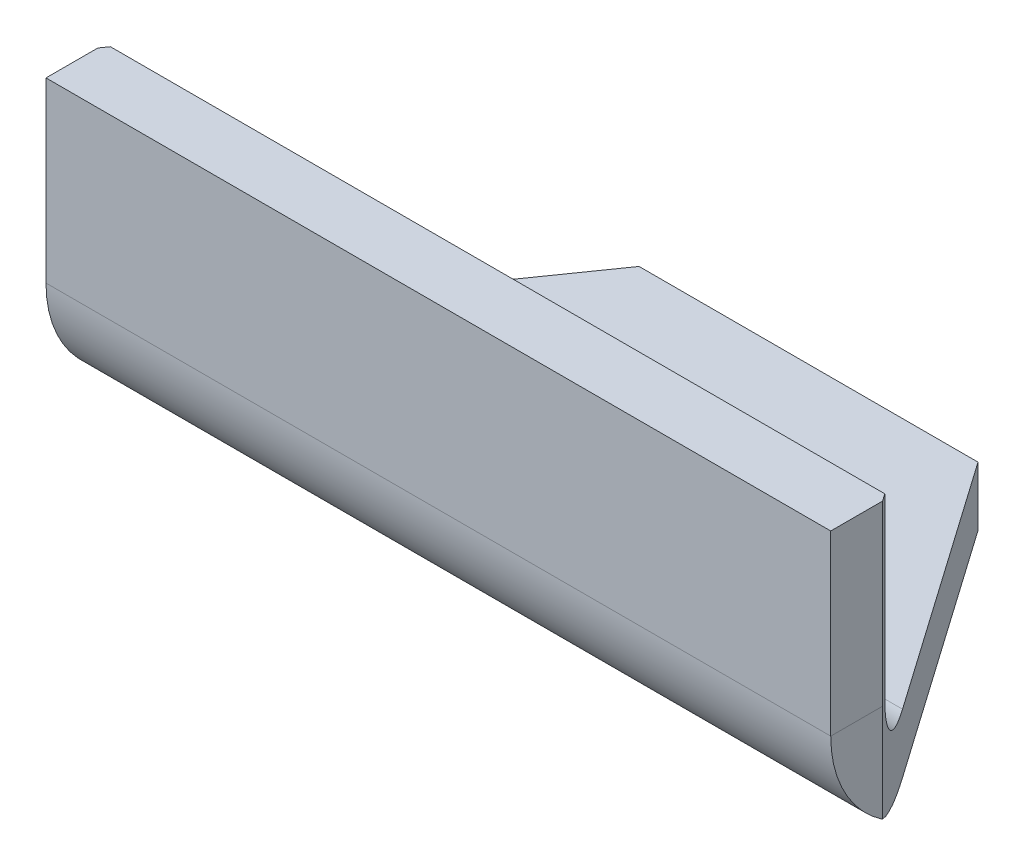
from build123d import *

# Parameters (mm, degrees)
SKETCH1_W                    = 106
SKETCH1_H                    = 50
BASE_FLANGE1_DEPTH           = 8
EDGE_FLANGE1_STRIP_W         = 48
EDGE_FLANGE1_STRIP_H         = 8
EDGE_FLANGE1_STRIP_CUT_DEPTH = 106
EDGE_FLANGE1_DEPTH           = 106
CHAMFER1_SIZE                = 43
CHAMFER1_SIZE2               = 30.108924143
MIRROR3_START                = 33.090682493
MIRROR3_OUTLINE_W            = 56
MIRROR3_OUTLINE_H            = 41
MIRROR3_DEPTH                = 24.663786763


# Read off the part's stored shape, not the designer's step: Mirror3
# Sheet-metal steps are written as plain solids
with BuildPart() as part:
    # Sketch1 → Base-Flange1 (new body)
    with BuildSketch(Plane(origin=(0, 0, 0), x_dir=(1, 0, 0), z_dir=(0, 1, 0))):
        Rectangle(SKETCH1_W, SKETCH1_H)
    extrude(amount=-BASE_FLANGE1_DEPTH)

    # Edge-Flange1 strip (across the edge) → Edge-Flange1 strip cut (cut)
    with BuildSketch(Plane(origin=(-53, 0, 25), x_dir=(0, 0, -1), z_dir=(1, 0, 0))):
        with Locations((-8, -4)):
            Rectangle(EDGE_FLANGE1_STRIP_W, EDGE_FLANGE1_STRIP_H)
    extrude(amount=EDGE_FLANGE1_STRIP_CUT_DEPTH, mode=Mode.SUBTRACT)

    # Edge-Flange1 section (across the edge) → Edge-Flange1 (add)
    with BuildSketch(Plane(origin=(-53, 0, 25), x_dir=(0, 0, -1), z_dir=(1, 0, 0))):
        with BuildLine():
            Line((0, 8), (0, 32))
            Line((0, 32), (8, 32))
            Line((8, 32), (8, 8))
            ThreePointArc((8, 8), (10.343145751, 2.343145751), (16, 0))
            Line((16, 0), (16, -8))
            ThreePointArc((16, -8), (4.686291501, -3.313708499), (0, 8))
        make_face()
    extrude(amount=EDGE_FLANGE1_DEPTH)

    # Chamfer1
    chamfer1_edges = [part.edges().sort_by_distance(p)[0] for p in [
        (-53, -4, -25),
    ]]
    chamfer1_side = [part.faces().sort_by_distance(p)[0] for p in [
        (-53, -0.640312424, -8),
    ]]
    chamfer(chamfer1_edges, length=CHAMFER1_SIZE, length2=CHAMFER1_SIZE2, reference=chamfer1_side[0])

    # Mirror3 outline → Mirror3 (cut)
    with BuildSketch(Plane(origin=(0, 0, 0), x_dir=(0.5735764363510512, 0, 0.8191520442889882), z_dir=(0.8191520442889882, 0, -0.5735764363510512)).offset(MIRROR3_START)):
        with Locations((19, -12.5)):
            Rectangle(MIRROR3_OUTLINE_W, MIRROR3_OUTLINE_H)
    extrude(amount=MIRROR3_DEPTH, mode=Mode.SUBTRACT)


solid = part.part
